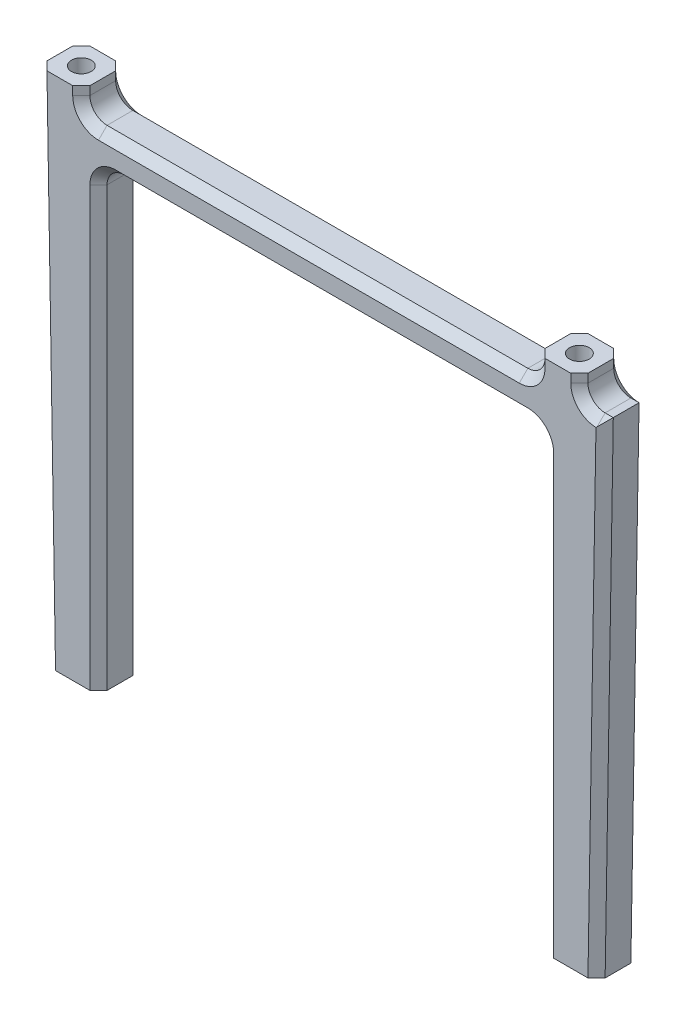
from build123d import *

# Parameters (mm, degrees)
BOSS_EXTRUDE1_DEPTH             = 5
F_3_0MM_DOWEL_HOLE1_D           = 2.8
F_3_0MM_DOWEL_HOLE1_DEPTH       = 10
F_3_0MM_DOWEL_HOLE1_CSINK_D     = 4
F_3_0MM_DOWEL_HOLE1_CSINK_ANGLE = 90
F_3_0MM_DOWEL_HOLE1_TIP         = 0.841204867
F_2_5MM_DOWEL_HOLE1_D           = 2.3
F_2_5MM_DOWEL_HOLE1_DEPTH       = 10
F_2_5MM_DOWEL_HOLE1_TIP         = 0.690989712
CUT_EXTRUDE1_REACH              = 68.046
SKETCH6_W                       = 3
SKETCH6_H                       = 3
FILLET2_R                       = 2
CHAMFER1_SIZE                   = 1


with BuildPart() as part:
    # Sketch1 → Boss-Extrude1 (new body)
    with BuildSketch(Plane.XY):
        Polygon((0, 0), (-25, 0), (-25, 3), (-33, 3), (-32, -56.991666088), (-26, -56.991666088), (-26, -4), (0, -4), align=None)
    extrude(amount=BOSS_EXTRUDE1_DEPTH)

    # Ø3.0mm Dowel Hole1
    with Locations(Plane(origin=(0, -56.991666088, 0), x_dir=(-1, 0, 0), z_dir=(0, -1, 0))):
        with Locations((29, -2.5)):
            CounterSinkHole(F_3_0MM_DOWEL_HOLE1_D / 2, F_3_0MM_DOWEL_HOLE1_CSINK_D / 2, depth=F_3_0MM_DOWEL_HOLE1_DEPTH, counter_sink_angle=F_3_0MM_DOWEL_HOLE1_CSINK_ANGLE)
            with Locations((0, 0, -(F_3_0MM_DOWEL_HOLE1_DEPTH + F_3_0MM_DOWEL_HOLE1_TIP / 2))):  # 118° drill point
                Cone(0, F_3_0MM_DOWEL_HOLE1_D / 2, F_3_0MM_DOWEL_HOLE1_TIP, mode=Mode.SUBTRACT)

    # Mirror1: part across plane


with BuildPart() as part_1:
    add(part.part)
    add(part.part.mirror(Plane(origin=(0, -4, 5), x_dir=(0, 0, 1), z_dir=(-1, 0, 0))))

    # Ø2.5mm Dowel Hole1
    with Locations(Plane(origin=(0, 3, 0), x_dir=(1, 0, 0), z_dir=(0, 1, 0))):
        with Locations((-30.5, -2.5), (27.5, -2.5)):
            Hole(F_2_5MM_DOWEL_HOLE1_D / 2, depth=F_2_5MM_DOWEL_HOLE1_DEPTH)
            with Locations((0, 0, -(F_2_5MM_DOWEL_HOLE1_DEPTH + F_2_5MM_DOWEL_HOLE1_TIP / 2))):  # 118° drill point
                Cone(0, F_2_5MM_DOWEL_HOLE1_D / 2, F_2_5MM_DOWEL_HOLE1_TIP, mode=Mode.SUBTRACT)

    # Sketch6 → Cut-Extrude1 (cut, up to next)
    with BuildSketch(Plane.XY.offset(5), mode=Mode.PRIVATE) as cut_extrude1_sk1:
        with Locations((-26.5, 1.5)):
            Rectangle(SKETCH6_W, SKETCH6_H)
    cut_extrude1_tool1 = extrude(cut_extrude1_sk1.sketch, amount=-CUT_EXTRUDE1_REACH, mode=Mode.PRIVATE) & part_1.part
    # Sketch6 → Cut-Extrude1 (cut, up to next)
    with BuildSketch(Plane.XY.offset(5), mode=Mode.PRIVATE) as cut_extrude1_sk2:
        with Locations((31.5, 1.5)):
            Rectangle(SKETCH6_W, SKETCH6_H)
    cut_extrude1_tool2 = extrude(cut_extrude1_sk2.sketch, amount=-CUT_EXTRUDE1_REACH, mode=Mode.PRIVATE) & part_1.part
    add(cut_extrude1_tool1.solids().sort_by_distance((-26.5, 1.5, 5))[0], mode=Mode.SUBTRACT)
    add(cut_extrude1_tool2.solids().sort_by_distance((31.5, 1.5, 5))[0], mode=Mode.SUBTRACT)

    # Fillet2
    fillet2_edges = [part_1.edges().sort_by_distance(p)[0] for p in [
        (-26, -4, 2.5),
        (25, 0, 2.5),
        (26, -4, 2.5),
        (-28, 0, 2.5),
        (30, 0, 2.5),
    ]]
    fillet(fillet2_edges, radius=FILLET2_R)

    # Chamfer1
    # the kernel refuses this chamfer: 1 mm, written as the material it takes off along each edge
    with BuildSketch(Plane(origin=(32, 2, 5), x_dir=(0, -1, 0), z_dir=(1, 0, 0))) as chamfer1_piece_1:
        Polygon((2 + CHAMFER1_SIZE, 0), (2, CHAMFER1_SIZE), (2, 0), align=None)
    revolve(axis=Axis((32, 2, 5), (0, 0, -1)), revolution_arc=90, mode=Mode.SUBTRACT)
    with BuildSketch(Plane(origin=(32, 2, 0), x_dir=(0, -1, 0), z_dir=(1, 0, 0))) as chamfer1_piece_2:
        Polygon((2 + CHAMFER1_SIZE, 0), (2, -CHAMFER1_SIZE), (2, 0), align=None)
    revolve(axis=Axis((32, 2, 0), (0, 0, -1)), revolution_arc=90, mode=Mode.SUBTRACT)
    with BuildSketch(Plane(origin=(-26, 2, 5), x_dir=(0, -1, 0), z_dir=(1, 0, 0))) as chamfer1_piece_3:
        Polygon((2, CHAMFER1_SIZE), (2 + CHAMFER1_SIZE, 0), (2, 0), align=None)
    revolve(axis=Axis((-26, 2, 5), (0, 0, -1)), revolution_arc=90, mode=Mode.SUBTRACT)
    with BuildSketch(Plane(origin=(-26, 2, 0), x_dir=(0, -1, 0), z_dir=(1, 0, 0))) as chamfer1_piece_4:
        Polygon((2 + CHAMFER1_SIZE, 0), (2, -CHAMFER1_SIZE), (2, 0), align=None)
    revolve(axis=Axis((-26, 2, 0), (0, 0, -1)), revolution_arc=90, mode=Mode.SUBTRACT)
    with BuildSketch(Plane(origin=(24, -6, 0), x_dir=(0, 1, 0), z_dir=(-1, 0, 0))) as chamfer1_piece_5:
        Polygon((2 + CHAMFER1_SIZE, 0), (2, -CHAMFER1_SIZE), (2, 0), align=None)
    revolve(axis=Axis((24, -6, 0), (0, 0, -1)), revolution_arc=90, mode=Mode.SUBTRACT)
    with BuildSketch(Plane(origin=(24, -6, 5), x_dir=(0, 1, 0), z_dir=(-1, 0, 0))) as chamfer1_piece_6:
        Polygon((2 + CHAMFER1_SIZE, 0), (2, CHAMFER1_SIZE), (2, 0), align=None)
    revolve(axis=Axis((24, -6, 5), (0, 0, -1)), revolution_arc=90, mode=Mode.SUBTRACT)
    with BuildSketch(Plane(origin=(-24, -6, 0), x_dir=(-1, 0, 0), z_dir=(0, -1, 0))) as chamfer1_piece_7:
        Polygon((2 + CHAMFER1_SIZE, 0), (2, -CHAMFER1_SIZE), (2, 0), align=None)
    revolve(axis=Axis((-24, -6, 0), (0, 0, -1)), revolution_arc=90, mode=Mode.SUBTRACT)
    with BuildSketch(Plane(origin=(-24, -6, 5), x_dir=(-1, 0, 0), z_dir=(0, -1, 0))) as chamfer1_piece_8:
        Polygon((2 + CHAMFER1_SIZE, 0), (2, CHAMFER1_SIZE), (2, 0), align=None)
    revolve(axis=Axis((-24, -6, 5), (0, 0, -1)), revolution_arc=90, mode=Mode.SUBTRACT)
    with BuildSketch(Plane(origin=(23, 2, 0), x_dir=(0, -1, 0), z_dir=(-1, 0, 0))) as chamfer1_piece_9:
        Polygon((2 + CHAMFER1_SIZE, 0), (2, CHAMFER1_SIZE), (2, 0), align=None)
    revolve(axis=Axis((23, 2, 0), (0, 0, 1)), revolution_arc=90, mode=Mode.SUBTRACT)
    with BuildSketch(Plane(origin=(23, 2, 5), x_dir=(0, -1, 0), z_dir=(-1, 0, 0))) as chamfer1_piece_10:
        Polygon((2, -CHAMFER1_SIZE), (2 + CHAMFER1_SIZE, 0), (2, 0), align=None)
    revolve(axis=Axis((23, 2, 5), (0, 0, 1)), revolution_arc=90, mode=Mode.SUBTRACT)
    with BuildSketch(Plane(origin=(-33.042861383, 5.571325785, 5), x_dir=(0.9994830708911936, 0.016660365281854946, 0.027495876610586452), z_dir=(0.01666666666666667, -0.9998611014647096, 0))) as chamfer1_piece_11:
        Polygon((CHAMFER1_SIZE * 0.999621916911, -CHAMFER1_SIZE * 0.0274958766106), (-CHAMFER1_SIZE * 0.0274958766106, -CHAMFER1_SIZE * 0.999621916911), (0, 0), align=None)
    extrude(amount=65.143365976, mode=Mode.SUBTRACT)
    with BuildSketch(Plane(origin=(-26, -59.563349076, 5), x_dir=(-0.9996219169112968, 0, 0.02749587661058651), z_dir=(0, 1, 0)), Plane(origin=(26, -59.563349076, 0), x_dir=(0.9996219169112968, 0, -0.02749587661058634), z_dir=(0, 1, 0))) as chamfer1_piece_12:
        Polygon((CHAMFER1_SIZE * 0.999621916911, -CHAMFER1_SIZE * 0.0274958766106), (-CHAMFER1_SIZE * 0.0274958766106, -CHAMFER1_SIZE * 0.999621916911), (0, 0), align=None)
    extrude(amount=53.563349076, mode=Mode.SUBTRACT)
    with BuildSketch(Plane(origin=(26, -59.563349076, 5), x_dir=(0.9996219169112968, 0, 0.02749587661058651), z_dir=(0, 1, 0)), Plane(origin=(-26, -59.563349076, 0), x_dir=(-0.9996219169112968, 0, -0.02749587661058639), z_dir=(0, 1, 0))) as chamfer1_piece_13:
        Polygon((CHAMFER1_SIZE * 0.999621916911, CHAMFER1_SIZE * 0.0274958766106), (-CHAMFER1_SIZE * 0.0274958766106, CHAMFER1_SIZE * 0.999621916911), (0, 0), align=None)
    extrude(amount=53.563349076, mode=Mode.SUBTRACT)
    with BuildSketch(Plane(origin=(32.992854437, 2.571325785, 0), x_dir=(-0.9994830708911936, 0.016660365281854946, -0.02749587661058633), z_dir=(-0.01666666666666667, -0.9998611014647096, 0))) as chamfer1_piece_14:
        Polygon((CHAMFER1_SIZE * 0.999621916911, -CHAMFER1_SIZE * 0.0274958766106), (-CHAMFER1_SIZE * 0.0274958766106, -CHAMFER1_SIZE * 0.999621916911), (0, 0), align=None)
    extrude(amount=62.142949222, mode=Mode.SUBTRACT)
    with BuildSketch(Plane(origin=(32.992854437, 2.571325785, 5), x_dir=(-0.9994830708911936, 0.016660365281854946, 0.027495876610586452), z_dir=(-0.01666666666666667, -0.9998611014647096, 0))) as chamfer1_piece_15:
        Polygon((CHAMFER1_SIZE * 0.999621916911, CHAMFER1_SIZE * 0.0274958766106), (-CHAMFER1_SIZE * 0.0274958766106, CHAMFER1_SIZE * 0.999621916911), (0, 0), align=None)
    extrude(amount=62.142949222, mode=Mode.SUBTRACT)
    with BuildSketch(Plane(origin=(-28, 5.571682988, 5), x_dir=(-0.9996219169112968, 0, 0.02749587661058651), z_dir=(0, -1, 0)), Plane(origin=(30, 5.571682988, 5), x_dir=(-0.9996219169112968, 0, 0.02749587661058651), z_dir=(0, -1, 0)), Plane(origin=(30, 2, 0), x_dir=(-0.9996219169112968, 0, -0.02749587661058634), z_dir=(0, 1, 0)), Plane(origin=(-28, 2, 0), x_dir=(-0.9996219169112968, 0, -0.02749587661058639), z_dir=(0, 1, 0)), Plane(origin=(25, 2, 5), x_dir=(0.9996219169112968, 0, 0.027495876610586605), z_dir=(0, 1, 0))) as chamfer1_piece_16:
        Polygon((CHAMFER1_SIZE * 0.999621916911, CHAMFER1_SIZE * 0.0274958766106), (-CHAMFER1_SIZE * 0.0274958766106, CHAMFER1_SIZE * 0.999621916911), (0, 0), align=None)
    extrude(amount=3.571682988, mode=Mode.SUBTRACT)
    with BuildSketch(Plane(origin=(-33.042861383, 5.571325785, 0), x_dir=(0.9994830708911936, 0.016660365281854946, -0.02749587661058633), z_dir=(0.01666666666666667, -0.9998611014647096, 0))) as chamfer1_piece_17:
        Polygon((CHAMFER1_SIZE * 0.999621916911, CHAMFER1_SIZE * 0.0274958766106), (-CHAMFER1_SIZE * 0.0274958766106, CHAMFER1_SIZE * 0.999621916911), (0, 0), align=None)
    extrude(amount=65.143365976, mode=Mode.SUBTRACT)
    with BuildSketch(Plane(origin=(23, 0, 0), x_dir=(0, 0.02749587661059217, 0.9996219169112965), z_dir=(-1, 0, 0)), Plane(origin=(-26, 0, 5), x_dir=(0, 0.027495876610583284, -0.9996219169112968), z_dir=(1, 0, 0))) as chamfer1_piece_18:
        Polygon((CHAMFER1_SIZE * 0.999621916911, -CHAMFER1_SIZE * 0.0274958766106), (-CHAMFER1_SIZE * 0.0274958766106, -CHAMFER1_SIZE * 0.999621916911), (0, 0), align=None)
    extrude(amount=49, mode=Mode.SUBTRACT)
    with BuildSketch(Plane(origin=(24, -4, 0), x_dir=(0, 0.9996219169112968, -0.027495876610586365), z_dir=(-1, 0, 0)), Plane(origin=(-24, -4, 5), x_dir=(0, 0.9996219169112968, 0.027495876610586487), z_dir=(1, 0, 0))) as chamfer1_piece_19:
        Polygon((CHAMFER1_SIZE * 0.999621916911, -CHAMFER1_SIZE * 0.0274958766106), (-CHAMFER1_SIZE * 0.0274958766106, -CHAMFER1_SIZE * 0.999621916911), (0, 0), align=None)
    extrude(amount=48, mode=Mode.SUBTRACT)
    with BuildSketch(Plane(origin=(25, 2, 0), x_dir=(0.9996219169112968, 0, -0.02749587661058654), z_dir=(0, 1, 0))) as chamfer1_piece_20:
        Polygon((CHAMFER1_SIZE * 0.999621916911, -CHAMFER1_SIZE * 0.0274958766106), (-CHAMFER1_SIZE * 0.0274958766106, -CHAMFER1_SIZE * 0.999621916911), (0, 0), align=None)
    extrude(amount=3.571682988, mode=Mode.SUBTRACT)
    with BuildSketch(Plane(origin=(35.521676042, 0, 0), x_dir=(0, -0.9996219169112968, -0.027495876610586365), z_dir=(-1, 0, 0)), Plane(origin=(32, 0, 5), x_dir=(0, -0.9996219169112968, 0.027495876610586497), z_dir=(1, 0, 0))) as chamfer1_piece_21:
        Polygon((CHAMFER1_SIZE * 0.999621916911, CHAMFER1_SIZE * 0.0274958766106), (-CHAMFER1_SIZE * 0.0274958766106, CHAMFER1_SIZE * 0.999621916911), (0, 0), align=None)
    extrude(amount=3.521676042, mode=Mode.SUBTRACT)


solid = part_1.part
